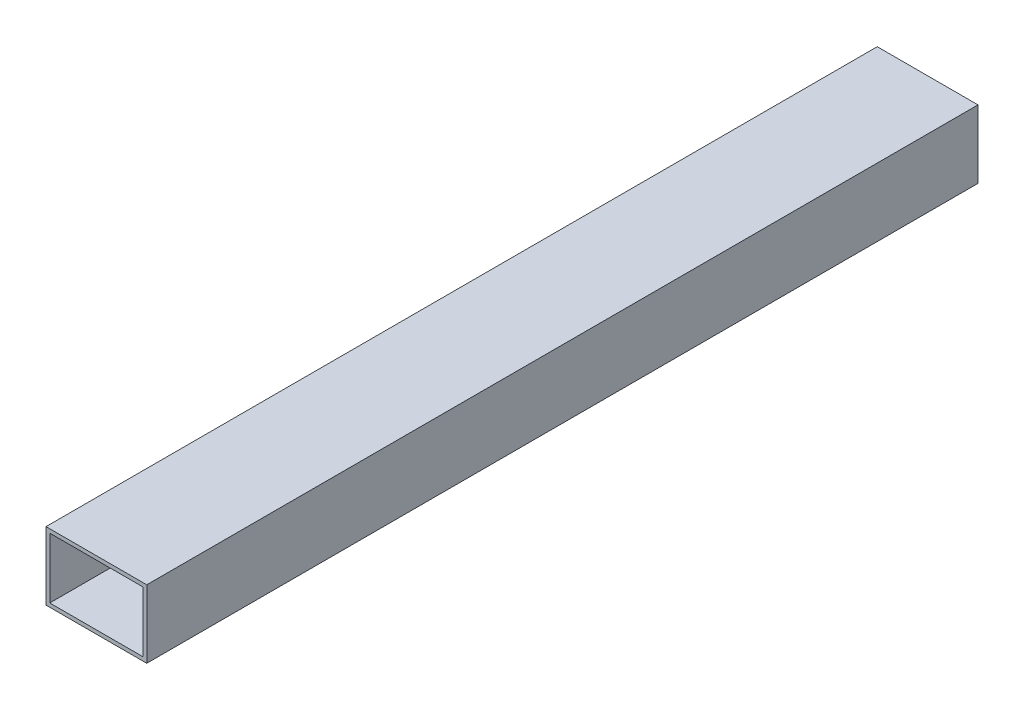
from build123d import *

# Parameters (mm, degrees)
ESQUISSE1_W        = 40
ESQUISSE1_H        = 27
ESQUISSE1_W_2      = 37
ESQUISSE1_H_2      = 24
BOSS_EXTRU_1_DEPTH = 330


with BuildPart() as part:
    # Esquisse1 → Boss.-Extru.1 (new body)
    with BuildSketch(Plane.XY):
        with Locations((20, 13.5)):
            Rectangle(ESQUISSE1_W, ESQUISSE1_H)
        with Locations((20, 13.5)):
            Rectangle(ESQUISSE1_W_2, ESQUISSE1_H_2, mode=Mode.SUBTRACT)
    extrude(amount=BOSS_EXTRU_1_DEPTH)


solid = part.part
